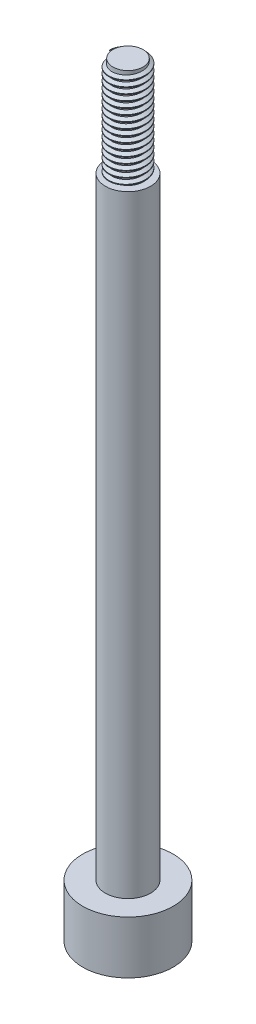
from build123d import *
from build123d.topology import SkipClean

# Parameters (mm, degrees)
FILETAGE1_PITCH         = 0.4
ENL_V_MAT_EXTRU_1_DEPTH = 2.6


with BuildPart() as part:
    # Esquisse1 → Révolution1 (revolve)
    with BuildSketch(Plane.XY, mode=Mode.PRIVATE) as r_volution1_sk:
        Polygon((0, 0), (3, 0), (3, 3.5), (1.5, 3.5), (1.5, 44.1), (1, 44.1), (1, 50.7), (0, 50.7), align=None)
    revolve(r_volution1_sk.sketch.rotate(Axis((0, 50.7, 0), (0, -1, 0)), 90), axis=Axis((0, 50.7, 0), (0, -1, 0)))

    # Filetage1: the profile of Profil de filetage2 profile screwed along a right-hand helix of 16.5 turns, 6 arcs to a turn; built about Z, then put on its axis
    with SkipClean():  # the faces are left unmerged after this step: merging them gives an invalid solid
        filetage1_z = Axis((0, 0, 0), (0, 0, 1))
        filetage1_corners = [(0.9997, 0, -0.000173205), (1.21650635, 0, 0.124999999), (1.21650635, 0, 0.174999999), (0.9997, 0, 0.300173204)]
        with BuildLine(mode=Mode.PRIVATE) as filetage1_profile:
            Line(filetage1_corners[0], filetage1_corners[1])
            Line(filetage1_corners[1], filetage1_corners[2])
            Line(filetage1_corners[2], filetage1_corners[3])
            Line(filetage1_corners[3], filetage1_corners[0])
        filetage1_cap = Face(filetage1_profile.wire())
        filetage1_turn_angles = [0, 30, 60, 90, 120, 150, 180, 210, 240, 270, 300, 330, 360]
        filetage1_turn_weights = [1, 0.8660254037844387, 1, 0.8660254037844387, 1, 0.8660254037844387, 1, 0.8660254037844387, 1, 0.8660254037844387, 1, 0.8660254037844387, 1]
        filetage1_turn_rails = [Edge.make_bspline([Vector(p[0], p[1], 0).rotate(filetage1_z, filetage1_turn_angles[k]) / filetage1_turn_weights[k] + Vector(0, 0, p[2] + FILETAGE1_PITCH * filetage1_turn_angles[k] / 360) for k in range(13)], [0, 0, 0, 1, 1, 2, 2, 3, 3, 4, 4, 5, 5, 6, 6, 6], 2, filetage1_turn_weights) for p in filetage1_corners]
        filetage1_turn_sides = [Face.make_surface_from_curves(filetage1_turn_rails[p[0]], filetage1_turn_rails[p[1]]) for p in [(0, 1), (1, 2), (2, 3), (3, 0)]]
        filetage1_last_angles = [5760, 5790, 5820, 5850, 5880, 5910, 5940]
        filetage1_last_weights = [1, 0.8660254037844387, 1, 0.8660254037844387, 1, 0.8660254037844387, 1]
        filetage1_last_rails = [Edge.make_bspline([Vector(p[0], p[1], 0).rotate(filetage1_z, filetage1_last_angles[k]) / filetage1_last_weights[k] + Vector(0, 0, p[2] + FILETAGE1_PITCH * filetage1_last_angles[k] / 360) for k in range(7)], [0, 0, 0, 1, 1, 2, 2, 3, 3, 3], 2, filetage1_last_weights) for p in filetage1_corners]
        filetage1_last_sides = [Face.make_surface_from_curves(filetage1_last_rails[p[0]], filetage1_last_rails[p[1]]) for p in [(0, 1), (1, 2), (2, 3), (3, 0)]]
        filetage1 = Plane(origin=(0, 50.7, 0), x_dir=(-1, 0, 0), z_dir=(0, -1, 0)) * Solid(Shell([*[p.moved(Location((0, 0, FILETAGE1_PITCH * i))) for i in range(16) for p in filetage1_turn_sides], *filetage1_last_sides, filetage1_cap, filetage1_cap.rotate(filetage1_z, 5940).moved(Location((0, 0, FILETAGE1_PITCH * 5940 / 360)))]))
        add(filetage1)

    # Esquisse9 → Enlèv. mat.-Extru.1 (cut)
    with SkipClean():  # the faces are left unmerged after this step: merging them gives an invalid solid
        with BuildSketch(Plane.XZ):
            Polygon((1.299038106, 0.75), (0, 1.5), (-1.299038106, 0.75), (-1.299038106, -0.75), (0, -1.5), (1.299038106, -0.75), align=None)
        extrude(amount=-ENL_V_MAT_EXTRU_1_DEPTH, mode=Mode.SUBTRACT)


solid = part.part
